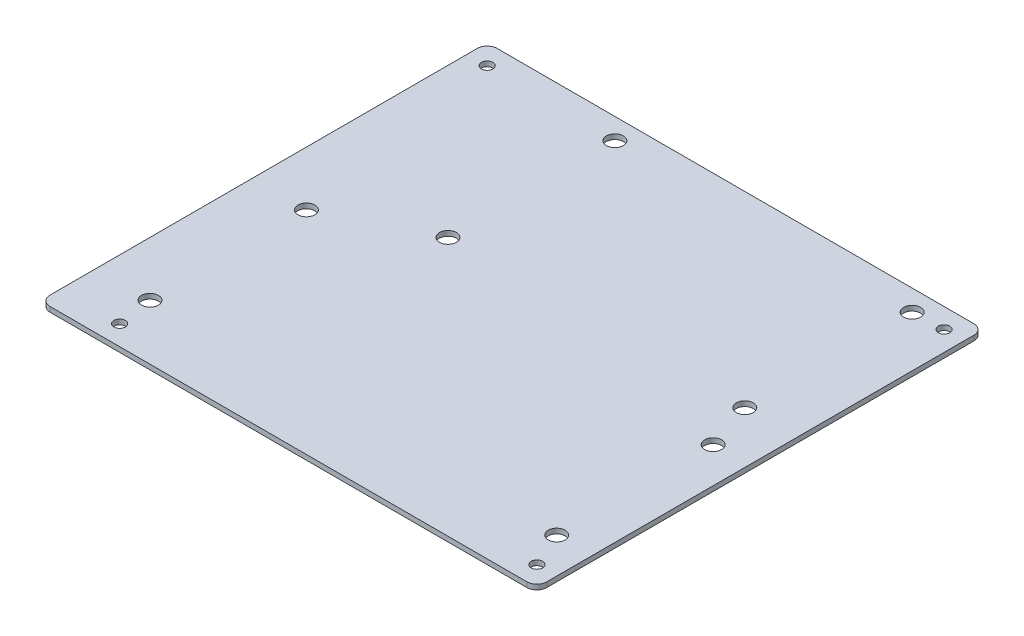
from build123d import *

# Parameters (mm, degrees)
SKETCH1_W           = 158.75
SKETCH1_H           = 142.875
BOSS_EXTRUDE1_DEPTH = 1.6002
FILLET1_R           = 3.175
SKETCH2_R           = 1.8288
CUT_EXTRUDE1_DEPTH  = 214.582276336
SKETCH5_R           = 2.7051
CUT_EXTRUDE2_DEPTH  = 214.582276336


with BuildPart() as part:
    # Sketch1 → Boss-Extrude1 (new body)
    with BuildSketch(Plane(origin=(0, 0, 0), x_dir=(1, 0, 0), z_dir=(0, 1, 0))):
        with Locations((79.375, 71.4375)):
            Rectangle(SKETCH1_W, SKETCH1_H)
    extrude(amount=BOSS_EXTRUDE1_DEPTH)

    # Fillet1
    fillet1_edges = [part.edges().sort_by_distance(p)[0] for p in [
        (158.75, 0.8001, 0),
        (0, 0.8001, -142.875),
        (158.75, 0.8001, -142.875),
        (0, 0.8001, 0),
    ]]
    fillet(fillet1_edges, radius=FILLET1_R)

    # Sketch2 → Cut-Extrude1 (cut, through all)
    with BuildSketch(Plane(origin=(0, 1.6002, 0), x_dir=(1, 0, 0), z_dir=(0, 1, 0))):
        with Locations((6.35, 136.525)):
            Circle(SKETCH2_R)
        with Locations((152.4, 136.525)):
            Circle(SKETCH2_R)
        with Locations((152.4, 6.35)):
            Circle(SKETCH2_R)
        with Locations((19.05, 6.35)):
            Circle(SKETCH2_R)
    extrude(amount=-CUT_EXTRUDE1_DEPTH, mode=Mode.SUBTRACT)

    # Sketch5 → Cut-Extrude2 (cut, through all)
    with BuildSketch(Plane(origin=(0, 1.6002, 0), x_dir=(1, 0, 0), z_dir=(0, 1, 0))):
        with Locations((47.549, 136.149)):
            Circle(SKETCH5_R)
        with Locations((142.519, 136.175)):
            Circle(SKETCH5_R)
        with Locations((47.625, 82.708)):
            Circle(SKETCH5_R)
        with Locations((142.215, 83.013)):
            Circle(SKETCH5_R)
        with Locations((17.4, 67.7)):
            Circle(SKETCH5_R)
        with Locations((147.382, 67.721)):
            Circle(SKETCH5_R)
        with Locations((147.4, 17.7)):
            Circle(SKETCH5_R)
        with Locations((17.4, 17.7)):
            Circle(SKETCH5_R)
    extrude(amount=-CUT_EXTRUDE2_DEPTH, mode=Mode.SUBTRACT)


solid = part.part
